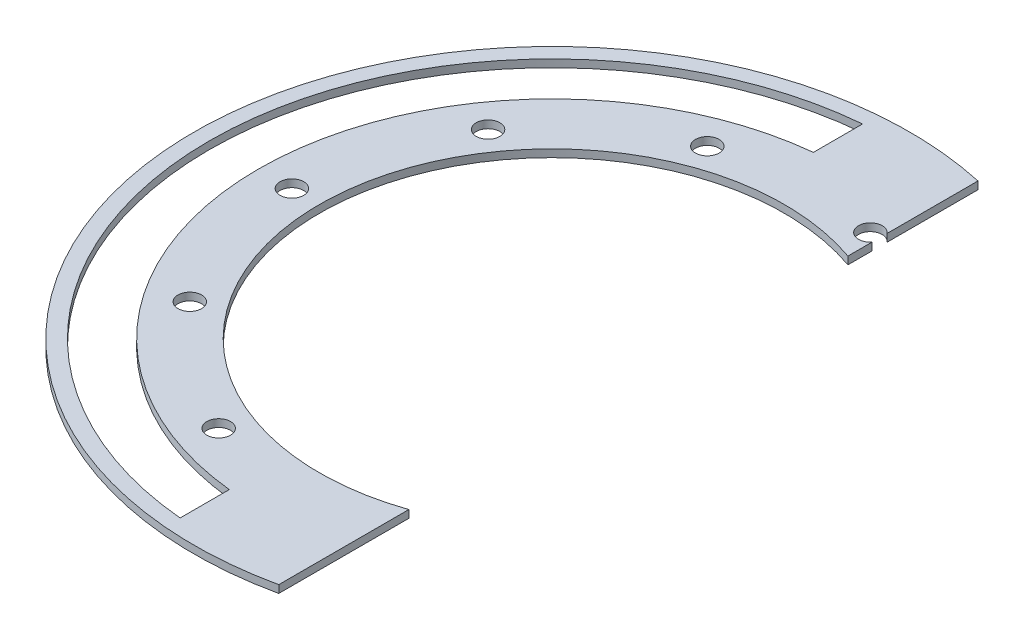
from build123d import *

# Parameters (mm, degrees)
BOSS_EXTRUDE1_DEPTH          = 152.4
BOSS_EXTRUDE1_DEPTH_BACK     = 152.4
SKETCH3_W                    = 304.8
SKETCH3_H                    = 1.5875
SKETCH4_W                    = 304.8
SKETCH4_H                    = 304.8
CUT_EXTRUDE1_DEPTH           = 2.54
F_10_0_1935_DIAMETER_HOLE1_D = 4.9149
CIRPATTERN1_START            = -0.79375
CIRPATTERN1_OUTLINE_R        = 2.45745
CIRPATTERN1_DEPTH            = 1.5875


# Read off the part's stored shape, not the designer's step: CirPattern1
with BuildPart() as part:
    # Sketch3 → Boss-Extrude1 (new, two sides: drawn at the far end of the back side and taken through both)
    with BuildSketch(Plane.XY.offset(-BOSS_EXTRUDE1_DEPTH_BACK)):
        Rectangle(SKETCH3_W, SKETCH3_H)
    extrude(amount=BOSS_EXTRUDE1_DEPTH + BOSS_EXTRUDE1_DEPTH_BACK)

    # Sketch4 → Cut-Extrude1 (cut)
    # profile 1 of 2: a face of its own
    with BuildSketch(Plane(origin=(0, 0.79375, 0), x_dir=(1, 0, 0), z_dir=(0, 1, 0))):
        Rectangle(SKETCH4_W, SKETCH4_H)
        with BuildLine():
            Line((15.875, -45.57424684), (15.875, -72.579138876))
            ThreePointArc((15.875, -72.579138876), (-74.295, 0), (15.875, 72.579138876))
            Line((15.875, 72.579138876), (15.875, 45.57424684))
            ThreePointArc((15.875, 45.57424684), (-48.26, 0), (15.875, -45.57424684))
        make_face(mode=Mode.SUBTRACT)
    # profile 2 of 2: a face of its own
    with BuildSketch(Plane(origin=(0, 0.79375, 0), x_dir=(1, 0, 0), z_dir=(0, 1, 0))):
        with BuildLine():
            Line((-6.35, 60.628368772), (-6.35, 70.835950618))
            ThreePointArc((-6.35, 70.835950618), (-71.12, 0), (-6.35, -70.835950618))
            Line((-6.35, -70.835950618), (-6.35, -60.628368772))
            ThreePointArc((-6.35, -60.628368772), (-60.96, 0), (-6.35, 60.628368772))
        make_face()
    extrude(amount=-CUT_EXTRUDE1_DEPTH, mode=Mode.SUBTRACT)

    # #10 (0.1935) Diameter Hole1 (through all)
    with Locations(Plane(origin=(-53.975, 0.79375, 0), x_dir=(0, 0, 1), z_dir=(0, 1, 0))):
        with Locations((0, 0)):
            Hole(F_10_0_1935_DIAMETER_HOLE1_D / 2)

    # CirPattern1 outline → CirPattern1 (cut)
    with BuildSketch(Plane(origin=(0, 0, 0), x_dir=(1, 0, 0), z_dir=(0, 1, 0)).offset(CIRPATTERN1_START)):
        with Locations((-44.21373159, 30.958788152)):
            Circle(CIRPATTERN1_OUTLINE_R)
        with Locations((-18.460537236, 50.719909207)):
            Circle(CIRPATTERN1_OUTLINE_R)
        with BuildLine():
            Line((15.875, 50.583714627), (15.875, 53.687978321))
            ThreePointArc((15.875, 53.687978321), (11.512307959, 52.135846474), (15.875, 50.583714627))
        make_face()
        with Locations((-44.21373159, -30.958788152)):
            Circle(CIRPATTERN1_OUTLINE_R)
        with Locations((-18.460537236, -50.719909207)):
            Circle(CIRPATTERN1_OUTLINE_R)
    extrude(amount=CIRPATTERN1_DEPTH, mode=Mode.SUBTRACT)


solid = part.part
